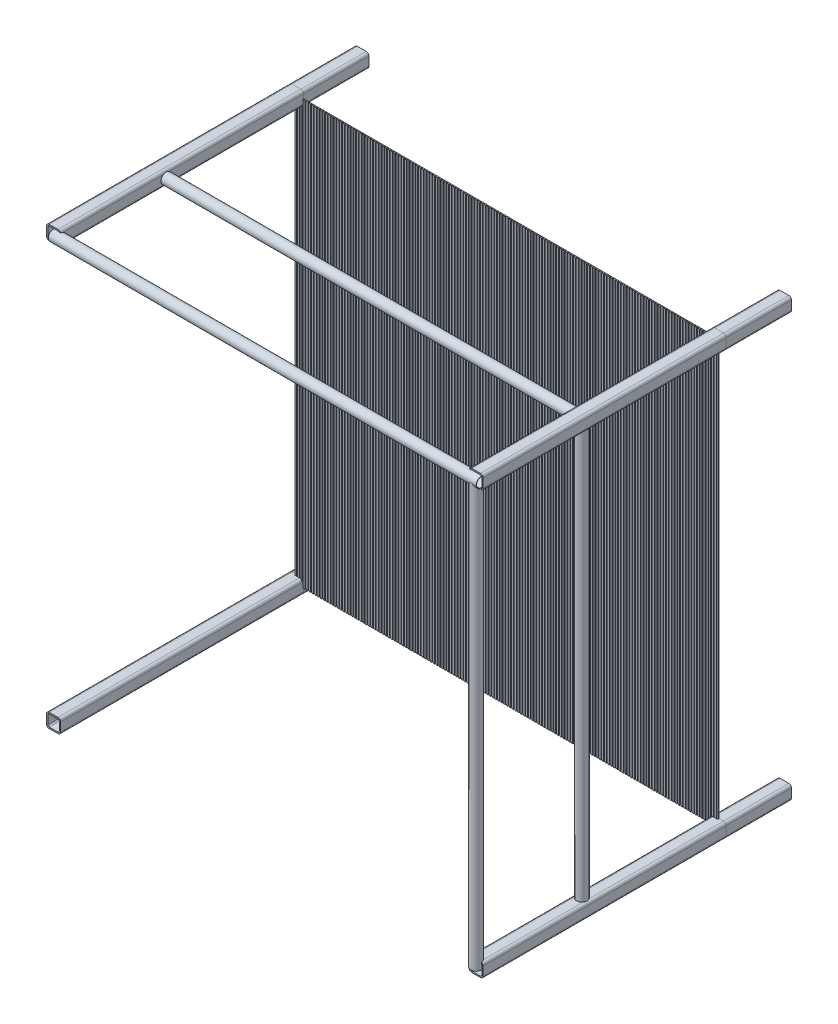
from build123d import *

# Parameters (mm, degrees)
TUBE_SQUARE_TS2X2X0_1875_1_DEPTH              = 235.458
TUBE_SQUARE_TS2X2X0_1875_1_2_DEPTH            = 876.3
TUBE_SQUARE_TS2X2X0_1875_1_3_DEPTH            = 235.458
TUBE_SQUARE_TS2X2X0_1875_1_4_DEPTH            = 876.3
TUBE_SQUARE_TS2X2X0_1875_1_5_DEPTH            = 235.458
TUBE_SQUARE_TS2X2X0_1875_1_6_DEPTH            = 876.3
TUBE_SQUARE_TS2X2X0_1875_1_7_DEPTH            = 235.458
TUBE_SQUARE_TS2X2X0_1875_1_8_DEPTH            = 876.3
AL_ROUND_TUBING_1_5_OD_X_0_063_WALL_1_OU_R    = 19.05
AL_ROUND_TUBING_1_5_OD_X_0_063_WALL_1_OU_R_2  = 17.399
AL_ROUND_TUBING_1_5_OD_X_0_063_WALL_1_DEPTH   = 1543.05
AL_ROUND_TUBING_1_5_OD_X_0_063_WALL_2_R       = 19.05
AL_ROUND_TUBING_1_5_OD_X_0_063_WALL_2_R_2     = 17.399
AL_ROUND_TUBING_1_5_OD_X_0_063_WALL_1_2_DEPTH = 1524.0000001
AL_START                                      = 1504
AL_ROUND_TUBING_1_5_OD_X_0_063_WALL_1_3_DEPTH = 40
AL_ROUND_TUBING_1_5_OD_X_0_063_WALL_4_R       = 19.05
AL_ROUND_TUBING_1_5_OD_X_0_063_WALL_4_R_2     = 17.399
AL_ROUND_TUBING_1_5_OD_X_0_063_WALL_1_4_DEPTH = 1543.05
AL_ROUND_TUBING_1_5_OD_X_0_063_WALL_5_R       = 19.05
AL_ROUND_TUBING_1_5_OD_X_0_063_WALL_5_R_2     = 17.399
AL_ROUND_TUBING_1_5_OD_X_0_063_WALL_1_5_DEPTH = 1524.0000001
AL_ROUND_TUBING_1_5_OD_X_0_063_WALL_1_6_DEPTH = 40
BOSS_EXTRUDE2_DEPTH                           = 5.08
SKETCH19_W                                    = 5.08
SKETCH19_H                                    = 1524
CUT_EXTRUDE1_DEPTH                            = 2.54


with BuildPart() as part:
    # Sketch13 → Tube (square) TS2X2X0.1875(1) (new body)
    with BuildSketch(Plane(origin=(0, 1524, 0), x_dir=(1, 0, 0), z_dir=(0, 0, 1))):
        with BuildLine():
            Line((-15.875, -25.4), (15.875, -25.4))
            ThreePointArc((15.875, -25.4), (22.610192091, -22.610192091), (25.4, -15.875))
            Line((25.4, -15.875), (25.4, 15.875))
            ThreePointArc((25.4, 15.875), (22.610192091, 22.610192091), (15.875, 25.4))
            Line((15.875, 25.4), (-15.875, 25.4))
            ThreePointArc((-15.875, 25.4), (-22.610192091, 22.610192091), (-25.4, 15.875))
            Line((-25.4, 15.875), (-25.4, -15.875))
            ThreePointArc((-25.4, -15.875), (-22.610192091, -22.610192091), (-15.875, -25.4))
        make_face()
        with BuildLine():
            Line((-15.875, -20.6375), (15.875, -20.6375))
            ThreePointArc((15.875, -20.6375), (19.242596045, -19.242596045), (20.6375, -15.875))
            Line((20.6375, -15.875), (20.6375, 15.875))
            ThreePointArc((20.6375, 15.875), (19.242596045, 19.242596045), (15.875, 20.6375))
            Line((15.875, 20.6375), (-15.875, 20.6375))
            ThreePointArc((-15.875, 20.6375), (-19.242596045, 19.242596045), (-20.6375, 15.875))
            Line((-20.6375, 15.875), (-20.6375, -15.875))
            ThreePointArc((-20.6375, -15.875), (-19.242596045, -19.242596045), (-15.875, -20.6375))
        make_face(mode=Mode.SUBTRACT)
    extrude(amount=-TUBE_SQUARE_TS2X2X0_1875_1_DEPTH)


with BuildPart() as body_2:
    # Sketch13 on segment 2 (carried to segment 2) → Tube _square_ TS2X2X0.1875_1 2 (new body)
    with BuildSketch(Plane(origin=(0, 1524, 0), x_dir=(1, 0, 0), z_dir=(0, 0, 1))):
        with BuildLine():
            Line((-15.875, -25.4), (15.875, -25.4))
            ThreePointArc((15.875, -25.4), (22.610192091, -22.610192091), (25.4, -15.875))
            Line((25.4, -15.875), (25.4, 15.875))
            ThreePointArc((25.4, 15.875), (22.610192091, 22.610192091), (15.875, 25.4))
            Line((15.875, 25.4), (-15.875, 25.4))
            ThreePointArc((-15.875, 25.4), (-22.610192091, 22.610192091), (-25.4, 15.875))
            Line((-25.4, 15.875), (-25.4, -15.875))
            ThreePointArc((-25.4, -15.875), (-22.610192091, -22.610192091), (-15.875, -25.4))
        make_face()
        with BuildLine():
            Line((-15.875, -20.6375), (15.875, -20.6375))
            ThreePointArc((15.875, -20.6375), (19.242596045, -19.242596045), (20.6375, -15.875))
            Line((20.6375, -15.875), (20.6375, 15.875))
            ThreePointArc((20.6375, 15.875), (19.242596045, 19.242596045), (15.875, 20.6375))
            Line((15.875, 20.6375), (-15.875, 20.6375))
            ThreePointArc((-15.875, 20.6375), (-19.242596045, 19.242596045), (-20.6375, 15.875))
            Line((-20.6375, 15.875), (-20.6375, -15.875))
            ThreePointArc((-20.6375, -15.875), (-19.242596045, -19.242596045), (-15.875, -20.6375))
        make_face(mode=Mode.SUBTRACT)
    extrude(amount=TUBE_SQUARE_TS2X2X0_1875_1_2_DEPTH)


with BuildPart() as body_3:
    # Sketch13 on segment 3 (carried to segment 3) → Tube _square_ TS2X2X0.1875_1 3 (new body)
    with BuildSketch(Plane(origin=(1524, 1524, -235.458), x_dir=(1, 0, 0), z_dir=(0, 0, 1))):
        with BuildLine():
            Line((-15.875, -25.4), (15.875, -25.4))
            ThreePointArc((15.875, -25.4), (22.610192091, -22.610192091), (25.4, -15.875))
            Line((25.4, -15.875), (25.4, 15.875))
            ThreePointArc((25.4, 15.875), (22.610192091, 22.610192091), (15.875, 25.4))
            Line((15.875, 25.4), (-15.875, 25.4))
            ThreePointArc((-15.875, 25.4), (-22.610192091, 22.610192091), (-25.4, 15.875))
            Line((-25.4, 15.875), (-25.4, -15.875))
            ThreePointArc((-25.4, -15.875), (-22.610192091, -22.610192091), (-15.875, -25.4))
        make_face()
        with BuildLine():
            Line((-15.875, -20.6375), (15.875, -20.6375))
            ThreePointArc((15.875, -20.6375), (19.242596045, -19.242596045), (20.6375, -15.875))
            Line((20.6375, -15.875), (20.6375, 15.875))
            ThreePointArc((20.6375, 15.875), (19.242596045, 19.242596045), (15.875, 20.6375))
            Line((15.875, 20.6375), (-15.875, 20.6375))
            ThreePointArc((-15.875, 20.6375), (-19.242596045, 19.242596045), (-20.6375, 15.875))
            Line((-20.6375, 15.875), (-20.6375, -15.875))
            ThreePointArc((-20.6375, -15.875), (-19.242596045, -19.242596045), (-15.875, -20.6375))
        make_face(mode=Mode.SUBTRACT)
    extrude(amount=TUBE_SQUARE_TS2X2X0_1875_1_3_DEPTH)


with BuildPart() as body_4:
    # Sketch13 on segment 4 (carried to segment 4) → Tube _square_ TS2X2X0.1875_1 4 (new body)
    with BuildSketch(Plane(origin=(1524, 1524, 0), x_dir=(1, 0, 0), z_dir=(0, 0, 1))):
        with BuildLine():
            Line((-15.875, -25.4), (15.875, -25.4))
            ThreePointArc((15.875, -25.4), (22.610192091, -22.610192091), (25.4, -15.875))
            Line((25.4, -15.875), (25.4, 15.875))
            ThreePointArc((25.4, 15.875), (22.610192091, 22.610192091), (15.875, 25.4))
            Line((15.875, 25.4), (-15.875, 25.4))
            ThreePointArc((-15.875, 25.4), (-22.610192091, 22.610192091), (-25.4, 15.875))
            Line((-25.4, 15.875), (-25.4, -15.875))
            ThreePointArc((-25.4, -15.875), (-22.610192091, -22.610192091), (-15.875, -25.4))
        make_face()
        with BuildLine():
            Line((-15.875, -20.6375), (15.875, -20.6375))
            ThreePointArc((15.875, -20.6375), (19.242596045, -19.242596045), (20.6375, -15.875))
            Line((20.6375, -15.875), (20.6375, 15.875))
            ThreePointArc((20.6375, 15.875), (19.242596045, 19.242596045), (15.875, 20.6375))
            Line((15.875, 20.6375), (-15.875, 20.6375))
            ThreePointArc((-15.875, 20.6375), (-19.242596045, 19.242596045), (-20.6375, 15.875))
            Line((-20.6375, 15.875), (-20.6375, -15.875))
            ThreePointArc((-20.6375, -15.875), (-19.242596045, -19.242596045), (-15.875, -20.6375))
        make_face(mode=Mode.SUBTRACT)
    extrude(amount=TUBE_SQUARE_TS2X2X0_1875_1_4_DEPTH)


with BuildPart() as body_5:
    # Sketch13 on segment 5 (carried to segment 5) → Tube _square_ TS2X2X0.1875_1 5 (new body)
    with BuildSketch(Plane(origin=(1524, 0, -235.458), x_dir=(1, 0, 0), z_dir=(0, 0, 1))):
        with BuildLine():
            Line((-15.875, -25.4), (15.875, -25.4))
            ThreePointArc((15.875, -25.4), (22.610192091, -22.610192091), (25.4, -15.875))
            Line((25.4, -15.875), (25.4, 15.875))
            ThreePointArc((25.4, 15.875), (22.610192091, 22.610192091), (15.875, 25.4))
            Line((15.875, 25.4), (-15.875, 25.4))
            ThreePointArc((-15.875, 25.4), (-22.610192091, 22.610192091), (-25.4, 15.875))
            Line((-25.4, 15.875), (-25.4, -15.875))
            ThreePointArc((-25.4, -15.875), (-22.610192091, -22.610192091), (-15.875, -25.4))
        make_face()
        with BuildLine():
            Line((-15.875, -20.6375), (15.875, -20.6375))
            ThreePointArc((15.875, -20.6375), (19.242596045, -19.242596045), (20.6375, -15.875))
            Line((20.6375, -15.875), (20.6375, 15.875))
            ThreePointArc((20.6375, 15.875), (19.242596045, 19.242596045), (15.875, 20.6375))
            Line((15.875, 20.6375), (-15.875, 20.6375))
            ThreePointArc((-15.875, 20.6375), (-19.242596045, 19.242596045), (-20.6375, 15.875))
            Line((-20.6375, 15.875), (-20.6375, -15.875))
            ThreePointArc((-20.6375, -15.875), (-19.242596045, -19.242596045), (-15.875, -20.6375))
        make_face(mode=Mode.SUBTRACT)
    extrude(amount=TUBE_SQUARE_TS2X2X0_1875_1_5_DEPTH)


with BuildPart() as body_6:
    # Sketch13 on segment 6 (carried to segment 6) → Tube _square_ TS2X2X0.1875_1 6 (new body)
    with BuildSketch(Plane(origin=(1524, 0, 0), x_dir=(1, 0, 0), z_dir=(0, 0, 1))):
        with BuildLine():
            Line((-15.875, -25.4), (15.875, -25.4))
            ThreePointArc((15.875, -25.4), (22.610192091, -22.610192091), (25.4, -15.875))
            Line((25.4, -15.875), (25.4, 15.875))
            ThreePointArc((25.4, 15.875), (22.610192091, 22.610192091), (15.875, 25.4))
            Line((15.875, 25.4), (-15.875, 25.4))
            ThreePointArc((-15.875, 25.4), (-22.610192091, 22.610192091), (-25.4, 15.875))
            Line((-25.4, 15.875), (-25.4, -15.875))
            ThreePointArc((-25.4, -15.875), (-22.610192091, -22.610192091), (-15.875, -25.4))
        make_face()
        with BuildLine():
            Line((-15.875, -20.6375), (15.875, -20.6375))
            ThreePointArc((15.875, -20.6375), (19.242596045, -19.242596045), (20.6375, -15.875))
            Line((20.6375, -15.875), (20.6375, 15.875))
            ThreePointArc((20.6375, 15.875), (19.242596045, 19.242596045), (15.875, 20.6375))
            Line((15.875, 20.6375), (-15.875, 20.6375))
            ThreePointArc((-15.875, 20.6375), (-19.242596045, 19.242596045), (-20.6375, 15.875))
            Line((-20.6375, 15.875), (-20.6375, -15.875))
            ThreePointArc((-20.6375, -15.875), (-19.242596045, -19.242596045), (-15.875, -20.6375))
        make_face(mode=Mode.SUBTRACT)
    extrude(amount=TUBE_SQUARE_TS2X2X0_1875_1_6_DEPTH)


with BuildPart() as body_7:
    # Sketch13 on segment 7 (carried to segment 7) → Tube _square_ TS2X2X0.1875_1 7 (new body)
    with BuildSketch(Plane.XY.offset(-235.458)):
        with BuildLine():
            Line((-15.875, -25.4), (15.875, -25.4))
            ThreePointArc((15.875, -25.4), (22.610192091, -22.610192091), (25.4, -15.875))
            Line((25.4, -15.875), (25.4, 15.875))
            ThreePointArc((25.4, 15.875), (22.610192091, 22.610192091), (15.875, 25.4))
            Line((15.875, 25.4), (-15.875, 25.4))
            ThreePointArc((-15.875, 25.4), (-22.610192091, 22.610192091), (-25.4, 15.875))
            Line((-25.4, 15.875), (-25.4, -15.875))
            ThreePointArc((-25.4, -15.875), (-22.610192091, -22.610192091), (-15.875, -25.4))
        make_face()
        with BuildLine():
            Line((-15.875, -20.6375), (15.875, -20.6375))
            ThreePointArc((15.875, -20.6375), (19.242596045, -19.242596045), (20.6375, -15.875))
            Line((20.6375, -15.875), (20.6375, 15.875))
            ThreePointArc((20.6375, 15.875), (19.242596045, 19.242596045), (15.875, 20.6375))
            Line((15.875, 20.6375), (-15.875, 20.6375))
            ThreePointArc((-15.875, 20.6375), (-19.242596045, 19.242596045), (-20.6375, 15.875))
            Line((-20.6375, 15.875), (-20.6375, -15.875))
            ThreePointArc((-20.6375, -15.875), (-19.242596045, -19.242596045), (-15.875, -20.6375))
        make_face(mode=Mode.SUBTRACT)
    extrude(amount=TUBE_SQUARE_TS2X2X0_1875_1_7_DEPTH)


with BuildPart() as body_8:
    # Sketch13 on segment 8 (carried to segment 8) → Tube _square_ TS2X2X0.1875_1 8 (new body)
    with BuildSketch(Plane.XY):
        with BuildLine():
            Line((-15.875, -25.4), (15.875, -25.4))
            ThreePointArc((15.875, -25.4), (22.610192091, -22.610192091), (25.4, -15.875))
            Line((25.4, -15.875), (25.4, 15.875))
            ThreePointArc((25.4, 15.875), (22.610192091, 22.610192091), (15.875, 25.4))
            Line((15.875, 25.4), (-15.875, 25.4))
            ThreePointArc((-15.875, 25.4), (-22.610192091, 22.610192091), (-25.4, 15.875))
            Line((-25.4, 15.875), (-25.4, -15.875))
            ThreePointArc((-25.4, -15.875), (-22.610192091, -22.610192091), (-15.875, -25.4))
        make_face()
        with BuildLine():
            Line((-15.875, -20.6375), (15.875, -20.6375))
            ThreePointArc((15.875, -20.6375), (19.242596045, -19.242596045), (20.6375, -15.875))
            Line((20.6375, -15.875), (20.6375, 15.875))
            ThreePointArc((20.6375, 15.875), (19.242596045, 19.242596045), (15.875, 20.6375))
            Line((15.875, 20.6375), (-15.875, 20.6375))
            ThreePointArc((-15.875, 20.6375), (-19.242596045, 19.242596045), (-20.6375, 15.875))
            Line((-20.6375, 15.875), (-20.6375, -15.875))
            ThreePointArc((-20.6375, -15.875), (-19.242596045, -19.242596045), (-15.875, -20.6375))
        make_face(mode=Mode.SUBTRACT)
    extrude(amount=TUBE_SQUARE_TS2X2X0_1875_1_8_DEPTH)


with BuildPart() as body_9:
    # Al round tubing 1.5 OD X 0.063 WALL(1): read off the stored shape, not the designer's step
    # Al round tubing 1.5 OD X 0.063 WALL(1) ou → Al round tubing 1.5 OD X 0.063 WALL(1) (new body)
    with BuildSketch(Plane.YZ):
        with Locations((1524, 876.3)):
            Circle(AL_ROUND_TUBING_1_5_OD_X_0_063_WALL_1_OU_R)
        with Locations((1524, 876.3)):
            Circle(AL_ROUND_TUBING_1_5_OD_X_0_063_WALL_1_OU_R_2, mode=Mode.SUBTRACT)
    extrude(amount=AL_ROUND_TUBING_1_5_OD_X_0_063_WALL_1_DEPTH)


with BuildPart() as body_10:
    # Al round tubing 1.5 OD X 0.063 WALL_ 2 → Al round tubing 1.5 OD X 0.063 WALL_1 2 (new body)
    with BuildSketch(Plane(origin=(0, 0, 0), x_dir=(1, 0, 0), z_dir=(0, 1, 0))):
        with Locations((1524, -876.3)):
            Circle(AL_ROUND_TUBING_1_5_OD_X_0_063_WALL_2_R)
        with Locations((1524, -876.3)):
            Circle(AL_ROUND_TUBING_1_5_OD_X_0_063_WALL_2_R_2, mode=Mode.SUBTRACT)
    extrude(amount=AL_ROUND_TUBING_1_5_OD_X_0_063_WALL_1_2_DEPTH)

    # Al round tubing 1.5 OD X 0.063 WALL_ 3 → Al round tubing 1.5 OD X 0.063 WALL_1 3 (cut)
    with BuildSketch(Plane.YZ.offset(AL_START)):
        with BuildLine():
            ThreePointArc((1524, 895.35), (1504.95, 876.3), (1524, 857.25))
            Line((1524, 857.25), (1524, 895.35))
        make_face()
    extrude(amount=AL_ROUND_TUBING_1_5_OD_X_0_063_WALL_1_3_DEPTH, mode=Mode.SUBTRACT)


with BuildPart() as body_11:
    # Al round tubing 1.5 OD X 0.063 WALL_ 4 → Al round tubing 1.5 OD X 0.063 WALL_1 4 (new body)
    with BuildSketch(Plane.YZ):
        with Locations((1524, 495.3)):
            Circle(AL_ROUND_TUBING_1_5_OD_X_0_063_WALL_4_R)
        with Locations((1524, 495.3)):
            Circle(AL_ROUND_TUBING_1_5_OD_X_0_063_WALL_4_R_2, mode=Mode.SUBTRACT)
    extrude(amount=AL_ROUND_TUBING_1_5_OD_X_0_063_WALL_1_4_DEPTH)


with BuildPart() as body_12:
    # Al round tubing 1.5 OD X 0.063 WALL_ 5 → Al round tubing 1.5 OD X 0.063 WALL_1 5 (new body)
    with BuildSketch(Plane(origin=(0, 0, 0), x_dir=(1, 0, 0), z_dir=(0, 1, 0))):
        with Locations((1524, -495.3)):
            Circle(AL_ROUND_TUBING_1_5_OD_X_0_063_WALL_5_R)
        with Locations((1524, -495.3)):
            Circle(AL_ROUND_TUBING_1_5_OD_X_0_063_WALL_5_R_2, mode=Mode.SUBTRACT)
    extrude(amount=AL_ROUND_TUBING_1_5_OD_X_0_063_WALL_1_5_DEPTH)

    # Al round tubing 1.5 OD X 0.063 WALL_ 6 → Al round tubing 1.5 OD X 0.063 WALL_1 6 (cut)
    with BuildSketch(Plane.YZ.offset(AL_START)):
        with BuildLine():
            ThreePointArc((1524, 514.35), (1504.95, 495.3), (1524, 476.25))
            Line((1524, 476.25), (1524, 514.35))
        make_face()
    extrude(amount=AL_ROUND_TUBING_1_5_OD_X_0_063_WALL_1_6_DEPTH, mode=Mode.SUBTRACT)


with BuildPart() as body_13:
    # 3DSketch1 → Boss-Extrude2 (new body)
    with BuildSketch(Plane(origin=(0, 0, 0), x_dir=(0.7071067811865476, 0.7071067811865476, 0), z_dir=(0, 0, 1))):
        Polygon((0, 0), (1077.630734528, -1077.630734528), (2155.261469057, 0), (1077.630734528, 1077.630734528), align=None)
    extrude(amount=BOSS_EXTRUDE2_DEPTH)


with BuildPart() as cut_extrude1_tool:
    # Sketch19 → Cut-Extrude1 (new body)
    with BuildSketch(Plane.XY.offset(5.08)):
        with Locations((7.62, 762)):
            Rectangle(SKETCH19_W, SKETCH19_H)
        with Locations((17.78, 762)):
            Rectangle(SKETCH19_W, SKETCH19_H)
        with Locations((27.94, 762)):
            Rectangle(SKETCH19_W, SKETCH19_H)
        with Locations((38.1, 762)):
            Rectangle(SKETCH19_W, SKETCH19_H)
        with Locations((48.26, 762)):
            Rectangle(SKETCH19_W, SKETCH19_H)
        with Locations((58.42, 762)):
            Rectangle(SKETCH19_W, SKETCH19_H)
        with Locations((68.58, 762)):
            Rectangle(SKETCH19_W, SKETCH19_H)
        with Locations((78.74, 762)):
            Rectangle(SKETCH19_W, SKETCH19_H)
        with Locations((88.9, 762)):
            Rectangle(SKETCH19_W, SKETCH19_H)
        with Locations((99.06, 762)):
            Rectangle(SKETCH19_W, SKETCH19_H)
        with Locations((109.22, 762)):
            Rectangle(SKETCH19_W, SKETCH19_H)
        with Locations((119.38, 762)):
            Rectangle(SKETCH19_W, SKETCH19_H)
        with Locations((129.54, 762)):
            Rectangle(SKETCH19_W, SKETCH19_H)
        with Locations((139.7, 762)):
            Rectangle(SKETCH19_W, SKETCH19_H)
        with Locations((149.86, 762)):
            Rectangle(SKETCH19_W, SKETCH19_H)
        with Locations((160.02, 762)):
            Rectangle(SKETCH19_W, SKETCH19_H)
        with Locations((170.18, 762)):
            Rectangle(SKETCH19_W, SKETCH19_H)
        with Locations((180.34, 762)):
            Rectangle(SKETCH19_W, SKETCH19_H)
        with Locations((190.5, 762)):
            Rectangle(SKETCH19_W, SKETCH19_H)
        with Locations((200.66, 762)):
            Rectangle(SKETCH19_W, SKETCH19_H)
        with Locations((210.82, 762)):
            Rectangle(SKETCH19_W, SKETCH19_H)
        with Locations((220.98, 762)):
            Rectangle(SKETCH19_W, SKETCH19_H)
        with Locations((231.14, 762)):
            Rectangle(SKETCH19_W, SKETCH19_H)
        with Locations((241.3, 762)):
            Rectangle(SKETCH19_W, SKETCH19_H)
        with Locations((251.46, 762)):
            Rectangle(SKETCH19_W, SKETCH19_H)
        with Locations((261.62, 762)):
            Rectangle(SKETCH19_W, SKETCH19_H)
        with Locations((271.78, 762)):
            Rectangle(SKETCH19_W, SKETCH19_H)
        with Locations((281.94, 762)):
            Rectangle(SKETCH19_W, SKETCH19_H)
        with Locations((292.1, 762)):
            Rectangle(SKETCH19_W, SKETCH19_H)
        with Locations((302.26, 762)):
            Rectangle(SKETCH19_W, SKETCH19_H)
        with Locations((312.42, 762)):
            Rectangle(SKETCH19_W, SKETCH19_H)
        with Locations((322.58, 762)):
            Rectangle(SKETCH19_W, SKETCH19_H)
        with Locations((332.74, 762)):
            Rectangle(SKETCH19_W, SKETCH19_H)
        with Locations((342.9, 762)):
            Rectangle(SKETCH19_W, SKETCH19_H)
        with Locations((353.06, 762)):
            Rectangle(SKETCH19_W, SKETCH19_H)
        with Locations((363.22, 762)):
            Rectangle(SKETCH19_W, SKETCH19_H)
        with Locations((373.38, 762)):
            Rectangle(SKETCH19_W, SKETCH19_H)
        with Locations((383.54, 762)):
            Rectangle(SKETCH19_W, SKETCH19_H)
        with Locations((393.7, 762)):
            Rectangle(SKETCH19_W, SKETCH19_H)
        with Locations((403.86, 762)):
            Rectangle(SKETCH19_W, SKETCH19_H)
        with Locations((414.02, 762)):
            Rectangle(SKETCH19_W, SKETCH19_H)
        with Locations((424.18, 762)):
            Rectangle(SKETCH19_W, SKETCH19_H)
        with Locations((434.34, 762)):
            Rectangle(SKETCH19_W, SKETCH19_H)
        with Locations((444.5, 762)):
            Rectangle(SKETCH19_W, SKETCH19_H)
        with Locations((454.66, 762)):
            Rectangle(SKETCH19_W, SKETCH19_H)
        with Locations((464.82, 762)):
            Rectangle(SKETCH19_W, SKETCH19_H)
        with Locations((474.98, 762)):
            Rectangle(SKETCH19_W, SKETCH19_H)
        with Locations((485.14, 762)):
            Rectangle(SKETCH19_W, SKETCH19_H)
        with Locations((495.3, 762)):
            Rectangle(SKETCH19_W, SKETCH19_H)
        with Locations((505.46, 762)):
            Rectangle(SKETCH19_W, SKETCH19_H)
        with Locations((515.62, 762)):
            Rectangle(SKETCH19_W, SKETCH19_H)
        with Locations((525.78, 762)):
            Rectangle(SKETCH19_W, SKETCH19_H)
        with Locations((535.94, 762)):
            Rectangle(SKETCH19_W, SKETCH19_H)
        with Locations((546.1, 762)):
            Rectangle(SKETCH19_W, SKETCH19_H)
        with Locations((556.26, 762)):
            Rectangle(SKETCH19_W, SKETCH19_H)
        with Locations((566.42, 762)):
            Rectangle(SKETCH19_W, SKETCH19_H)
        with Locations((576.58, 762)):
            Rectangle(SKETCH19_W, SKETCH19_H)
        with Locations((586.74, 762)):
            Rectangle(SKETCH19_W, SKETCH19_H)
        with Locations((596.9, 762)):
            Rectangle(SKETCH19_W, SKETCH19_H)
        with Locations((607.06, 762)):
            Rectangle(SKETCH19_W, SKETCH19_H)
        with Locations((617.22, 762)):
            Rectangle(SKETCH19_W, SKETCH19_H)
        with Locations((627.38, 762)):
            Rectangle(SKETCH19_W, SKETCH19_H)
        with Locations((637.54, 762)):
            Rectangle(SKETCH19_W, SKETCH19_H)
        with Locations((647.7, 762)):
            Rectangle(SKETCH19_W, SKETCH19_H)
        with Locations((657.86, 762)):
            Rectangle(SKETCH19_W, SKETCH19_H)
        with Locations((668.02, 762)):
            Rectangle(SKETCH19_W, SKETCH19_H)
        with Locations((678.18, 762)):
            Rectangle(SKETCH19_W, SKETCH19_H)
        with Locations((688.34, 762)):
            Rectangle(SKETCH19_W, SKETCH19_H)
        with Locations((698.5, 762)):
            Rectangle(SKETCH19_W, SKETCH19_H)
        with Locations((708.66, 762)):
            Rectangle(SKETCH19_W, SKETCH19_H)
        with Locations((718.82, 762)):
            Rectangle(SKETCH19_W, SKETCH19_H)
        with Locations((728.98, 762)):
            Rectangle(SKETCH19_W, SKETCH19_H)
        with Locations((739.14, 762)):
            Rectangle(SKETCH19_W, SKETCH19_H)
        with Locations((749.3, 762)):
            Rectangle(SKETCH19_W, SKETCH19_H)
        with Locations((759.46, 762)):
            Rectangle(SKETCH19_W, SKETCH19_H)
        with Locations((769.62, 762)):
            Rectangle(SKETCH19_W, SKETCH19_H)
        with Locations((779.78, 762)):
            Rectangle(SKETCH19_W, SKETCH19_H)
        with Locations((789.94, 762)):
            Rectangle(SKETCH19_W, SKETCH19_H)
        with Locations((800.1, 762)):
            Rectangle(SKETCH19_W, SKETCH19_H)
        with Locations((810.26, 762)):
            Rectangle(SKETCH19_W, SKETCH19_H)
        with Locations((820.42, 762)):
            Rectangle(SKETCH19_W, SKETCH19_H)
        with Locations((830.58, 762)):
            Rectangle(SKETCH19_W, SKETCH19_H)
        with Locations((840.74, 762)):
            Rectangle(SKETCH19_W, SKETCH19_H)
        with Locations((850.9, 762)):
            Rectangle(SKETCH19_W, SKETCH19_H)
        with Locations((861.06, 762)):
            Rectangle(SKETCH19_W, SKETCH19_H)
        with Locations((871.22, 762)):
            Rectangle(SKETCH19_W, SKETCH19_H)
        with Locations((881.38, 762)):
            Rectangle(SKETCH19_W, SKETCH19_H)
        with Locations((891.54, 762)):
            Rectangle(SKETCH19_W, SKETCH19_H)
        with Locations((901.7, 762)):
            Rectangle(SKETCH19_W, SKETCH19_H)
        with Locations((911.86, 762)):
            Rectangle(SKETCH19_W, SKETCH19_H)
        with Locations((922.02, 762)):
            Rectangle(SKETCH19_W, SKETCH19_H)
        with Locations((932.18, 762)):
            Rectangle(SKETCH19_W, SKETCH19_H)
        with Locations((942.34, 762)):
            Rectangle(SKETCH19_W, SKETCH19_H)
        with Locations((952.5, 762)):
            Rectangle(SKETCH19_W, SKETCH19_H)
        with Locations((962.66, 762)):
            Rectangle(SKETCH19_W, SKETCH19_H)
        with Locations((972.82, 762)):
            Rectangle(SKETCH19_W, SKETCH19_H)
        with Locations((982.98, 762)):
            Rectangle(SKETCH19_W, SKETCH19_H)
        with Locations((993.14, 762)):
            Rectangle(SKETCH19_W, SKETCH19_H)
        with Locations((1003.3, 762)):
            Rectangle(SKETCH19_W, SKETCH19_H)
        with Locations((1013.46, 762)):
            Rectangle(SKETCH19_W, SKETCH19_H)
        with Locations((1023.62, 762)):
            Rectangle(SKETCH19_W, SKETCH19_H)
        with Locations((1033.78, 762)):
            Rectangle(SKETCH19_W, SKETCH19_H)
        with Locations((1043.94, 762)):
            Rectangle(SKETCH19_W, SKETCH19_H)
        with Locations((1054.1, 762)):
            Rectangle(SKETCH19_W, SKETCH19_H)
        with Locations((1064.26, 762)):
            Rectangle(SKETCH19_W, SKETCH19_H)
        with Locations((1074.42, 762)):
            Rectangle(SKETCH19_W, SKETCH19_H)
        with Locations((1084.58, 762)):
            Rectangle(SKETCH19_W, SKETCH19_H)
        with Locations((1094.74, 762)):
            Rectangle(SKETCH19_W, SKETCH19_H)
        with Locations((1104.9, 762)):
            Rectangle(SKETCH19_W, SKETCH19_H)
        with Locations((1115.06, 762)):
            Rectangle(SKETCH19_W, SKETCH19_H)
        with Locations((1125.22, 762)):
            Rectangle(SKETCH19_W, SKETCH19_H)
        with Locations((1135.38, 762)):
            Rectangle(SKETCH19_W, SKETCH19_H)
        with Locations((1145.54, 762)):
            Rectangle(SKETCH19_W, SKETCH19_H)
        with Locations((1155.7, 762)):
            Rectangle(SKETCH19_W, SKETCH19_H)
        with Locations((1165.86, 762)):
            Rectangle(SKETCH19_W, SKETCH19_H)
        with Locations((1176.02, 762)):
            Rectangle(SKETCH19_W, SKETCH19_H)
        with Locations((1186.18, 762)):
            Rectangle(SKETCH19_W, SKETCH19_H)
        with Locations((1196.34, 762)):
            Rectangle(SKETCH19_W, SKETCH19_H)
        with Locations((1206.5, 762)):
            Rectangle(SKETCH19_W, SKETCH19_H)
        with Locations((1216.66, 762)):
            Rectangle(SKETCH19_W, SKETCH19_H)
        with Locations((1226.82, 762)):
            Rectangle(SKETCH19_W, SKETCH19_H)
        with Locations((1236.98, 762)):
            Rectangle(SKETCH19_W, SKETCH19_H)
        with Locations((1247.14, 762)):
            Rectangle(SKETCH19_W, SKETCH19_H)
        with Locations((1257.3, 762)):
            Rectangle(SKETCH19_W, SKETCH19_H)
        with Locations((1267.46, 762)):
            Rectangle(SKETCH19_W, SKETCH19_H)
        with Locations((1277.62, 762)):
            Rectangle(SKETCH19_W, SKETCH19_H)
        with Locations((1287.78, 762)):
            Rectangle(SKETCH19_W, SKETCH19_H)
        with Locations((1297.94, 762)):
            Rectangle(SKETCH19_W, SKETCH19_H)
        with Locations((1308.1, 762)):
            Rectangle(SKETCH19_W, SKETCH19_H)
        with Locations((1318.26, 762)):
            Rectangle(SKETCH19_W, SKETCH19_H)
        with Locations((1328.42, 762)):
            Rectangle(SKETCH19_W, SKETCH19_H)
        with Locations((1338.58, 762)):
            Rectangle(SKETCH19_W, SKETCH19_H)
        with Locations((1348.74, 762)):
            Rectangle(SKETCH19_W, SKETCH19_H)
        with Locations((1358.9, 762)):
            Rectangle(SKETCH19_W, SKETCH19_H)
        with Locations((1369.06, 762)):
            Rectangle(SKETCH19_W, SKETCH19_H)
        with Locations((1379.22, 762)):
            Rectangle(SKETCH19_W, SKETCH19_H)
        with Locations((1389.38, 762)):
            Rectangle(SKETCH19_W, SKETCH19_H)
        with Locations((1399.54, 762)):
            Rectangle(SKETCH19_W, SKETCH19_H)
        with Locations((1409.7, 762)):
            Rectangle(SKETCH19_W, SKETCH19_H)
        with Locations((1419.86, 762)):
            Rectangle(SKETCH19_W, SKETCH19_H)
        with Locations((1430.02, 762)):
            Rectangle(SKETCH19_W, SKETCH19_H)
        with Locations((1440.18, 762)):
            Rectangle(SKETCH19_W, SKETCH19_H)
        with Locations((1450.34, 762)):
            Rectangle(SKETCH19_W, SKETCH19_H)
        with Locations((1460.5, 762)):
            Rectangle(SKETCH19_W, SKETCH19_H)
        with Locations((1470.66, 762)):
            Rectangle(SKETCH19_W, SKETCH19_H)
        with Locations((1480.82, 762)):
            Rectangle(SKETCH19_W, SKETCH19_H)
        with Locations((1490.98, 762)):
            Rectangle(SKETCH19_W, SKETCH19_H)
        with Locations((1501.14, 762)):
            Rectangle(SKETCH19_W, SKETCH19_H)
        with Locations((1511.3, 762)):
            Rectangle(SKETCH19_W, SKETCH19_H)
        with Locations((1521.46, 762)):
            Rectangle(SKETCH19_W, SKETCH19_H)
    extrude(amount=-CUT_EXTRUDE1_DEPTH)


with BuildPart() as body_2_1:
    add(body_2.part)

    # Cut-Extrude1: cut by cut_extrude1_tool
    add(cut_extrude1_tool.part, mode=Mode.SUBTRACT)


with BuildPart() as body_4_1:
    add(body_4.part)

    # Cut-Extrude1: cut by cut_extrude1_tool
    add(cut_extrude1_tool.part, mode=Mode.SUBTRACT)


with BuildPart() as body_6_1:
    add(body_6.part)

    # Cut-Extrude1: cut by cut_extrude1_tool
    add(cut_extrude1_tool.part, mode=Mode.SUBTRACT)


with BuildPart() as body_8_1:
    add(body_8.part)

    # Cut-Extrude1: cut by cut_extrude1_tool
    add(cut_extrude1_tool.part, mode=Mode.SUBTRACT)


with BuildPart() as body_13_1:
    add(body_13.part)

    # Cut-Extrude1: cut by cut_extrude1_tool
    add(cut_extrude1_tool.part, mode=Mode.SUBTRACT)


solid = Compound([part.part, body_3.part, body_5.part, body_7.part, body_9.part, body_10.part, body_11.part, body_12.part, body_2_1.part, body_4_1.part, body_6_1.part, body_8_1.part, body_13_1.part])
